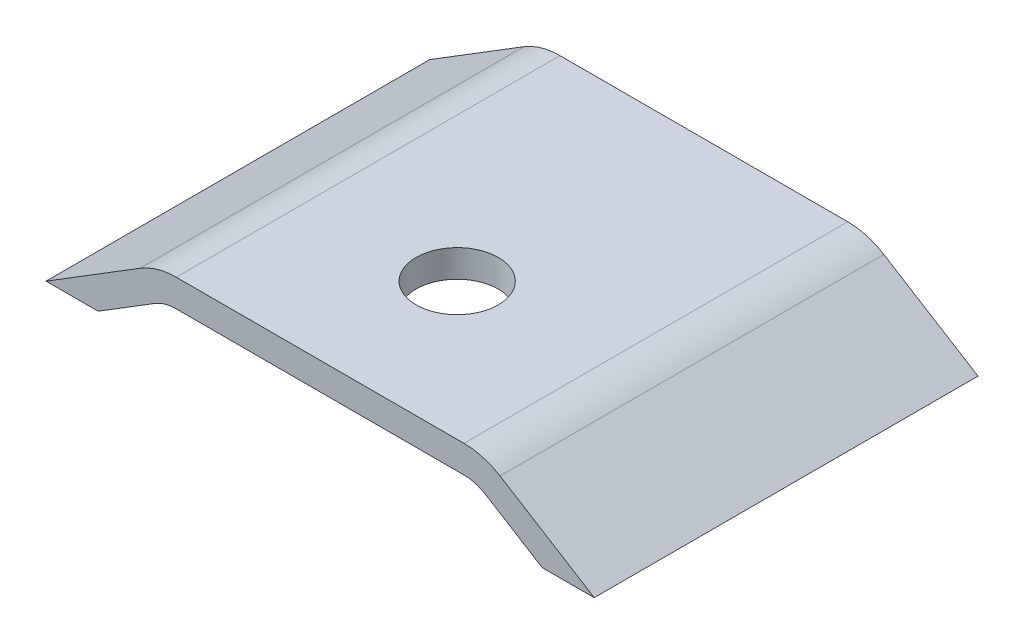
from build123d import *

# Parameters (mm, degrees)
BOSS_EXTRUDE1_DEPTH = 71.12
FILLET1_R           = 12.7
CUT_EXTRUDE1_REACH  = 89.63
CUT_EXTRUDE2_REACH  = 90.318
SKETCH5_R           = 7.62


with BuildPart() as part:
    # Sketch1 → Boss-Extrude1 (new body)
    with BuildSketch(Plane.XY):
        Polygon((-50.8, -6.35), (-30.274406604, 6.35), (30.274406604, 6.35), (50.8, -6.35), align=None)
    extrude(amount=BOSS_EXTRUDE1_DEPTH)

    # Fillet1
    fillet1_edges = [part.edges().sort_by_distance(p)[0] for p in [
        (-30.274406604, 6.35, 35.56),
        (30.274406604, 6.35, 35.56),
    ]]
    fillet(fillet1_edges, radius=FILLET1_R)

    # Sketch3 → Cut-Extrude1 (cut, up to next)
    with BuildSketch(Plane.XY.offset(71.12), mode=Mode.PRIVATE) as cut_extrude1_sk1:
        with BuildLine():
            Line((-48.127080212, -10.669942107), (48.127080212, -10.669942107))
            Line((48.127080212, -10.669942107), (30.672478799, 0.12991316))
            ThreePointArc((30.672478799, 0.12991316), (28.747261025, 0.979438528), (26.663099116, 1.27))
            Line((26.663099116, 1.27), (-26.663099116, 1.27))
            ThreePointArc((-26.663099116, 1.27), (-28.747261025, 0.979438528), (-30.672478799, 0.12991316))
            Line((-30.672478799, 0.12991316), (-48.127080212, -10.669942107))
        make_face()
    cut_extrude1_tool1 = extrude(cut_extrude1_sk1.sketch, amount=-CUT_EXTRUDE1_REACH, mode=Mode.PRIVATE) & part.part
    add(cut_extrude1_tool1.solids().sort_by_distance((0, -5.204738, 71.12))[0], mode=Mode.SUBTRACT)

    # Sketch5 → Cut-Extrude2 (cut, up to next)
    with BuildSketch(Plane(origin=(0, 6.35, 0), x_dir=(1, 0, 0), z_dir=(0, 1, 0)), mode=Mode.PRIVATE) as cut_extrude2_sk1:
        with Locations((0, -45.72)):
            Circle(SKETCH5_R)
    cut_extrude2_tool1 = extrude(cut_extrude2_sk1.sketch, amount=-CUT_EXTRUDE2_REACH, mode=Mode.PRIVATE) & part.part
    add(cut_extrude2_tool1.solids().sort_by_distance((0, 6.35, 45.72))[0], mode=Mode.SUBTRACT)


solid = part.part
